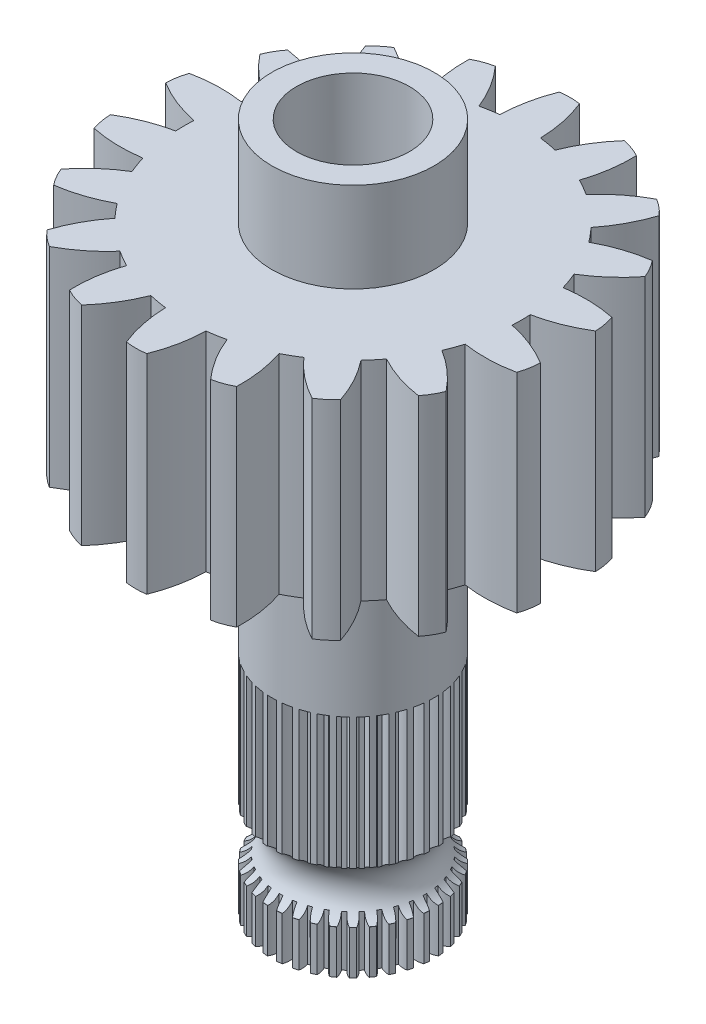
from build123d import *

# Parameters (mm, degrees)
SKETCH1_R           = 21.15
BOSS_EXTRUDE1_DEPTH = 20.3
SKETCH2_R           = 7.9
BOSS_EXTRUDE2_DEPTH = 8.75
BOSS_EXTRUDE3_START = 37.8
SKETCH3_R           = 7.9
BOSS_EXTRUDE3_DEPTH = 37.8
SKETCH5_R           = 21.15
SKETCH5_R_2         = 16.4
CUT_EXTRUDE2_DEPTH  = 27
BOSS_EXTRUDE4_DEPTH = 20.3
CIRPATTERN1_COUNT   = 18
SKETCH6_R           = 3.5
CUT_EXTRUDE3_DEPTH  = 5
CUT_EXTRUDE4_DEPTH  = 22
CIRPATTERN2_COUNT   = 36
SKETCH9_R           = 5.5
CUT_EXTRUDE5_DEPTH  = 14.5
BOSS_EXTRUDE5_START = 3.5
BOSS_EXTRUDE5_DEPTH = 3.5
CUT_EXTRUDE6_START  = -51
SKETCH11_R          = 5.5
CUT_EXTRUDE6_DEPTH  = 51


with BuildPart() as part:
    # Sketch1 → Boss-Extrude1 (new body)
    with BuildSketch(Plane(origin=(0, 0, 0), x_dir=(1, 0, 0), z_dir=(0, 1, 0))):
        Circle(SKETCH1_R)
    extrude(amount=BOSS_EXTRUDE1_DEPTH)

    # Sketch2 → Boss-Extrude2 (add)
    with BuildSketch(Plane(origin=(0, 20.3, 0), x_dir=(1, 0, 0), z_dir=(0, 1, 0))):
        Circle(SKETCH2_R)
    extrude(amount=BOSS_EXTRUDE2_DEPTH)

    # Sketch3 → Boss-Extrude3 (add)
    with BuildSketch(Plane.XZ.offset(BOSS_EXTRUDE3_START)):
        Circle(SKETCH3_R)
    extrude(amount=-BOSS_EXTRUDE3_DEPTH)

    # Sketch5 → Cut-Extrude2 (cut)
    with BuildSketch(Plane.XZ):
        Circle(SKETCH5_R)
        Circle(SKETCH5_R_2, mode=Mode.SUBTRACT)
    extrude(amount=-CUT_EXTRUDE2_DEPTH, mode=Mode.SUBTRACT)

    # Sketch4 → Boss-Extrude4 (add)
    with BuildSketch(Plane.XZ):
        with BuildLine():
            ThreePointArc((1.973179732, 16.280864895), (0, 16.4), (-1.973179732, 16.280864895))
            ThreePointArc((-1.973179732, 16.280864895), (-1.693396544, 18.720406673), (-0.988758397, 21.072666819))
            ThreePointArc((-0.988758397, 21.072666819), (0, 21.15), (0.988758397, 21.072666819))
            ThreePointArc((0.988758397, 21.072666819), (1.693396544, 18.720406673), (1.973179732, 16.280864895))
        make_face()
    boss_extrude4 = extrude(amount=-BOSS_EXTRUDE4_DEPTH)

    # CirPattern1: Boss-Extrude4 ×18 about axis
    cirpattern1_axis = Axis((0, 0, 0), (0, -1, 0))
    for i in range(1, CIRPATTERN1_COUNT):
        add(boss_extrude4.rotate(cirpattern1_axis, i * 360 / CIRPATTERN1_COUNT))

    # Sketch6 → Cut-Extrude3 (cut)
    with BuildSketch(Plane(origin=(0, 29.05, 0), x_dir=(1, 0, 0), z_dir=(0, 1, 0))):
        Circle(SKETCH6_R)
    extrude(amount=-CUT_EXTRUDE3_DEPTH, mode=Mode.SUBTRACT)

    # Sketch7 → Cut-Extrude4 (cut)
    with BuildSketch(Plane.XZ.offset(37.8)):
        with BuildLine():
            ThreePointArc((0.43709384, 7.887898895), (0, 7.9), (-0.43709384, 7.887898895))
            ThreePointArc((-0.43709384, 7.887898895), (-0.256233833, 7.458249318), (-0.185037914, 6.997553928))
            ThreePointArc((-0.185037914, 6.997553928), (0, 7), (0.185037914, 6.997553928))
            ThreePointArc((0.185037914, 6.997553928), (0.256233833, 7.458249318), (0.43709384, 7.887898895))
        make_face()
    cut_extrude4 = extrude(amount=-CUT_EXTRUDE4_DEPTH, mode=Mode.SUBTRACT)

    # CirPattern2: Cut-Extrude4 ×36 about axis
    cirpattern2_axis = Axis((0, -37.8, 0), (0, -1, 0))
    for i in range(1, CIRPATTERN2_COUNT):
        add(cut_extrude4.rotate(cirpattern2_axis, i * 360 / CIRPATTERN2_COUNT), mode=Mode.SUBTRACT)

    # Sketch8 → Cut-Revolve1 (revolve, cut)
    with BuildSketch(Plane.XY):
        with BuildLine():
            Line((7.887898895, -33.55), (8.641262248, -33.55))
            Line((8.641262248, -33.55), (8.641262248, -28.550321722))
            Line((8.641262248, -28.550321722), (7.843964535, -28.550321722))
            ThreePointArc((7.843964535, -28.550321722), (6.341566316, -31.063556126), (7.887898895, -33.55))
        make_face()
    revolve(axis=Axis((0, -41.1425, 0), (0, 1, 0)), mode=Mode.SUBTRACT)

    # Sketch9 → Cut-Extrude5 (cut)
    with BuildSketch(Plane(origin=(0, 29.05, 0), x_dir=(1, 0, 0), z_dir=(0, 1, 0))):
        Circle(SKETCH9_R)
    extrude(amount=-CUT_EXTRUDE5_DEPTH, mode=Mode.SUBTRACT)

    # Sketch10 → Boss-Extrude5 (add)
    with BuildSketch(Plane(origin=(0, 14.55, 0), x_dir=(1, 0, 0), z_dir=(0, 1, 0)).offset(BOSS_EXTRUDE5_START)):
        with BuildLine():
            Line((-1.5, -5.291502622), (-1.5, 5.291502622))
            ThreePointArc((-1.5, 5.291502622), (-5.5, 0), (-1.5, -5.291502622))
        make_face()
        with BuildLine():
            ThreePointArc((1.5, -5.291502622), (5.5, 0), (1.5, 5.291502622))
            Line((1.5, 5.291502622), (1.5, -5.291502622))
        make_face()
    extrude(amount=-BOSS_EXTRUDE5_DEPTH)

    # Sketch11 → Cut-Extrude6 (cut)
    with BuildSketch(Plane.XZ.offset(37.8).offset(CUT_EXTRUDE6_START)):
        Circle(SKETCH11_R)
    extrude(amount=CUT_EXTRUDE6_DEPTH, mode=Mode.SUBTRACT)


solid = part.part
